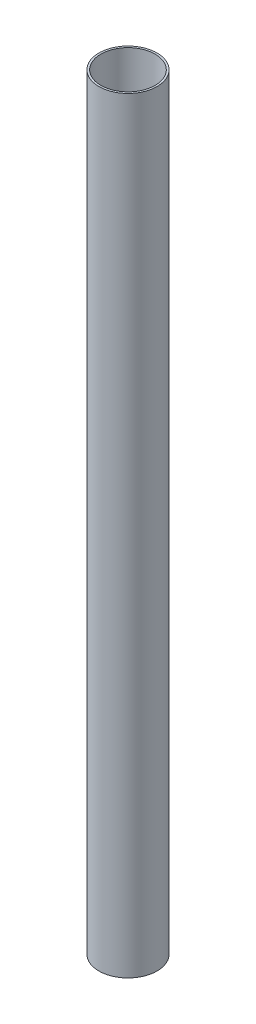
from build123d import *

# Parameters (mm, degrees)
SKETCH1_W = 1.9304
SKETCH1_H = 762


with BuildPart() as part:
    # Sketch1 → Revolve1 (revolve)
    with BuildSketch(Plane.XY):
        with Locations((27.9527, -353.313767116)):
            Rectangle(SKETCH1_W, SKETCH1_H)
    revolve(axis=Axis((0, 0, 0), (0, -1, 0)))


solid = part.part
